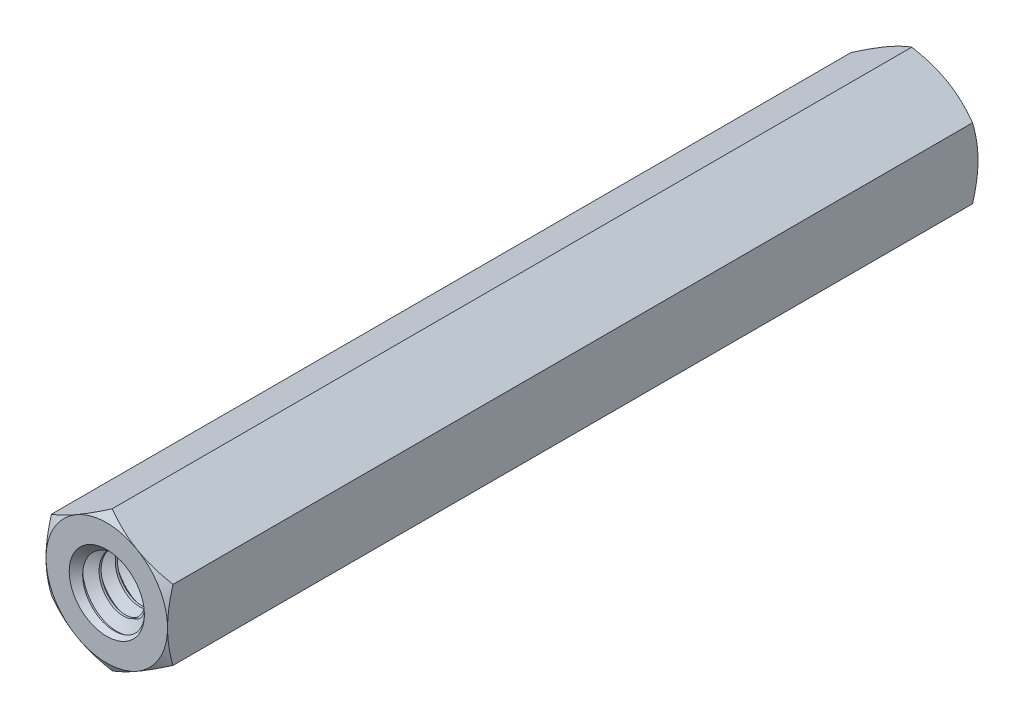
from build123d import *

# Parameters (mm, degrees)
EXTRUDE1_DEPTH          = 15.875
EXTRUDE1_DEPTH_BACK     = 15.875
SKETCH1_R               = 1.4224
SWEEP1_PITCH            = 0.635
EXTRUDE2_DEPTH          = 33.588805921
SKETCH8_OUTSIDE_W       = 129.756
SKETCH8_OUTSIDE_H       = 130.494
SKETCH8_OUTSIDE_R       = 2.38125
EXTRUDE4_DEPTH          = 33.588805921
EXTRUDE4_DRAFT          = -60
MIRROR1_COPY_1_SKETCH_W = 129.756
MIRROR1_COPY_1_SKETCH_H = 130.494
MIRROR1_COPY_1_SKETCH_R = 2.38125
MIRROR1_COPY_1_DEPTH    = 33.588805921
MIRROR1_COPY_1_DRAFT    = -60
SKETCH9_W               = 19.05
SKETCH9_H               = 1.4732


with BuildPart() as part:
    # Sketch1 → Extrude1 (new, two sides: drawn at the far end of the back side and taken through both)
    with BuildSketch(Plane.XY.offset(-EXTRUDE1_DEPTH_BACK)):
        Polygon((0, 2.749630657), (-2.38125, 1.374815329), (-2.38125, -1.374815329), (0, -2.749630657), (2.38125, -1.374815329), (2.38125, 1.374815329), align=None)
        Circle(SKETCH1_R, mode=Mode.SUBTRACT)
    extrude(amount=EXTRUDE1_DEPTH + EXTRUDE1_DEPTH_BACK)

    # Sweep1: the profile of Sketch12 profile screwed along a right-hand helix of 51 turns, 6 arcs to a turn; built about Z, then put on its axis
    sweep1_z = Axis((0, 0, 0), (0, 0, 1))
    sweep1_corners = [(1.4227, 0, -0.555798205), (1.4227, 0, 0.000173205), (1.009955401, 0, -0.238125), (1.009955401, 0, -0.3175)]
    with BuildLine(mode=Mode.PRIVATE) as sweep1_profile:
        Line(sweep1_corners[0], sweep1_corners[1])
        Line(sweep1_corners[1], sweep1_corners[2])
        Line(sweep1_corners[2], sweep1_corners[3])
        Line(sweep1_corners[3], sweep1_corners[0])
    sweep1_cap = Face(sweep1_profile.wire())
    sweep1_turn_angles = [0, 30, 60, 90, 120, 150, 180, 210, 240, 270, 300, 330, 360, 390, 420, 450, 480, 510, 540, 570, 600, 630, 660, 690, 720]
    sweep1_turn_weights = [1, 0.8660254037844387, 1, 0.8660254037844387, 1, 0.8660254037844387, 1, 0.8660254037844387, 1, 0.8660254037844387, 1, 0.8660254037844387, 1, 0.8660254037844387, 1, 0.8660254037844387, 1, 0.8660254037844387, 1, 0.8660254037844387, 1, 0.8660254037844387, 1, 0.8660254037844387, 1]
    sweep1_turn_rails = [Edge.make_bspline([Vector(p[0], p[1], 0).rotate(sweep1_z, sweep1_turn_angles[k]) / sweep1_turn_weights[k] + Vector(0, 0, p[2] + SWEEP1_PITCH * sweep1_turn_angles[k] / 360) for k in range(25)], [0, 0, 0, 1, 1, 2, 2, 3, 3, 4, 4, 5, 5, 6, 6, 7, 7, 8, 8, 9, 9, 10, 10, 11, 11, 12, 12, 12], 2, sweep1_turn_weights) for p in sweep1_corners]
    sweep1_turn_sides = [Face.make_surface_from_curves(sweep1_turn_rails[p[0]], sweep1_turn_rails[p[1]]) for p in [(0, 1), (1, 2), (2, 3), (3, 0)]]
    sweep1_last_angles = [18000, 18030, 18060, 18090, 18120, 18150, 18180, 18210, 18240, 18270, 18300, 18330, 18360]
    sweep1_last_weights = [1, 0.8660254037844387, 1, 0.8660254037844387, 1, 0.8660254037844387, 1, 0.8660254037844387, 1, 0.8660254037844387, 1, 0.8660254037864864, 1]
    sweep1_last_rails = [Edge.make_bspline([Vector(p[0], p[1], 0).rotate(sweep1_z, sweep1_last_angles[k]) / sweep1_last_weights[k] + Vector(0, 0, p[2] + SWEEP1_PITCH * sweep1_last_angles[k] / 360) for k in range(13)], [0, 0, 0, 1, 1, 2, 2, 3, 3, 4, 4, 5, 5, 6, 6, 6], 2, sweep1_last_weights) for p in sweep1_corners]
    sweep1_last_sides = [Face.make_surface_from_curves(sweep1_last_rails[p[0]], sweep1_last_rails[p[1]]) for p in [(0, 1), (1, 2), (2, 3), (3, 0)]]
    sweep1 = Plane(origin=(0, 0, -15.875), x_dir=(0, 1, 0), z_dir=(0, 0, 1)) * Solid(Shell([*[p.moved(Location((0, 0, 2 * SWEEP1_PITCH * i))) for i in range(25) for p in sweep1_turn_sides], *sweep1_last_sides, sweep1_cap, sweep1_cap.rotate(sweep1_z, 18360).moved(Location((0, 0, SWEEP1_PITCH * 18360 / 360)))]))
    add(sweep1)

    # Sketch6 → Extrude2 (cut, through all)
    with BuildSketch(Plane(origin=(0, 0, -15.875), x_dir=(-1, 0, 0), z_dir=(0, 0, -1))):
        Polygon((0, 2.749630657), (-2.38125, 1.374815329), (-2.38125, -1.374815329), (0, -2.749630657), (2.38125, -1.374815329), (2.38125, 1.374815329), align=None)
    extrude2 = extrude(amount=EXTRUDE2_DEPTH, mode=Mode.SUBTRACT)

    # Extrude3 cone 1 section (through the dimple's axis) → Extrude3 (revolve, cut)
    with BuildSketch(Plane(origin=(0, 0, -15.875), x_dir=(0, 1, 0), z_dir=(1, 0, 0))):
        Polygon((0, 0), (1.4732, 0), (0, 1.579813584), align=None)
    extrude3 = revolve(axis=Axis((0, 0, -15.875), (0, 0, 1)), mode=Mode.SUBTRACT)


with BuildPart() as extrude4_tool:
    # Sketch8 outside → Extrude4 (with draft: the straight prism first)
    with BuildSketch(Plane(origin=(0, 0, -15.875), x_dir=(-1, 0, 0), z_dir=(0, 0, -1))):
        Rectangle(SKETCH8_OUTSIDE_W, SKETCH8_OUTSIDE_H)
        Circle(SKETCH8_OUTSIDE_R, mode=Mode.SUBTRACT)
    extrude(amount=-EXTRUDE4_DEPTH)
    # Extrude4: the draft: its side faces are tilted about the plane it starts from
    extrude4_sides = [extrude4_tool.faces().sort_by_distance(p)[0] for p in [
        (0, -65.247, 0.91940296),
        (-64.878, 0, 0.91940296),
        (0, 65.247, 0.91940296),
        (64.878, 0, 0.91940296),
        (2.38125, 0, 0.91940296),
    ]]
    draft(extrude4_sides, Plane(origin=(0, 0, -15.875), x_dir=(-1, 0, 0), z_dir=(0, 0, -1)), EXTRUDE4_DRAFT)


with BuildPart() as part_1:
    add(part.part)

    # Extrude4: cut by extrude4_tool
    add(extrude4_tool.part, mode=Mode.SUBTRACT)

    # Mirror1: Extrude2, Extrude3 across plane
    add(extrude2.mirror(Plane.XY), mode=Mode.SUBTRACT)
    add(extrude3.mirror(Plane.XY), mode=Mode.SUBTRACT)


with BuildPart() as mirror1_copy_1_tool:
    # Mirror1 copy 1 sketch → Mirror1 copy 1 (with draft: the straight prism first)
    with BuildSketch(Plane(origin=(0, 0, 15.875), x_dir=(-1, 0, 0), z_dir=(0, 0, 1))):
        Rectangle(MIRROR1_COPY_1_SKETCH_W, MIRROR1_COPY_1_SKETCH_H)
        Circle(MIRROR1_COPY_1_SKETCH_R, mode=Mode.SUBTRACT)
    extrude(amount=-MIRROR1_COPY_1_DEPTH)
    # Mirror1 copy 1: the draft: its side faces are tilted about the plane it starts from
    mirror1_copy_1_sides = [mirror1_copy_1_tool.faces().sort_by_distance(p)[0] for p in [
        (0, -65.247, -0.91940296),
        (-64.878, 0, -0.91940296),
        (0, 65.247, -0.91940296),
        (64.878, 0, -0.91940296),
        (2.38125, 0, -0.91940296),
    ]]
    draft(mirror1_copy_1_sides, Plane(origin=(0, 0, 15.875), x_dir=(-1, 0, 0), z_dir=(0, 0, 1)), MIRROR1_COPY_1_DRAFT)


with BuildPart() as part_2:
    add(part_1.part)

    # Mirror1 copy 1: cut by mirror1_copy_1_tool
    add(mirror1_copy_1_tool.part, mode=Mode.SUBTRACT)

    # Sketch9 → Revolve 2 (revolve)
    with BuildSketch(Plane(origin=(0, 0, 0), x_dir=(0, 0, -1), z_dir=(1, 0, 0)), mode=Mode.PRIVATE) as revolve_2_sk:
        with Locations((0, 0.7366)):
            Rectangle(SKETCH9_W, SKETCH9_H)
    revolve(revolve_2_sk.sketch.rotate(Axis((0, 0, 15.875), (0, 0, -1)), 270), axis=Axis((0, 0, 15.875), (0, 0, -1)))


solid = part_2.part
